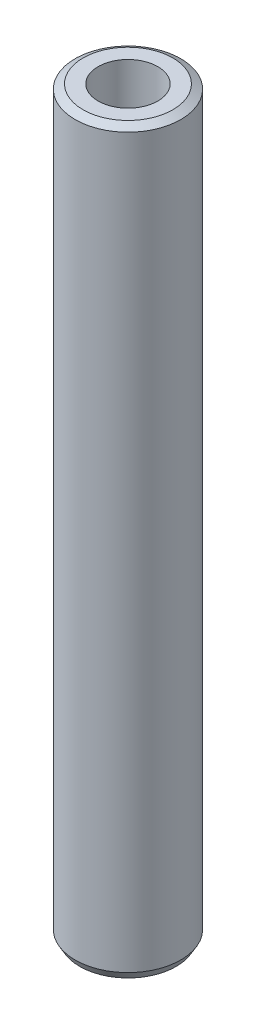
from build123d import *
from OCP.BRepFilletAPI import BRepFilletAPI_MakeChamfer

# Parameters (mm, degrees)
SKETCH1_R           = 37.5
BOSS_EXTRUDE1_DEPTH = 525.698947027
SKETCH2_R           = 21.197430428
CUT_EXTRUDE1_DEPTH  = 529.367185681
CHAMFER1_SIZE       = 3.242616752
CHAMFER1_SIZE2      = 5.616376964


with BuildPart() as part:
    # Sketch1 → Boss-Extrude1 (new body)
    with BuildSketch(Plane(origin=(0, 0, 0), x_dir=(1, 0, 0), z_dir=(0, 1, 0))):
        Circle(SKETCH1_R)
    extrude(amount=BOSS_EXTRUDE1_DEPTH)

    # Sketch2 → Cut-Extrude1 (cut, through all)
    with BuildSketch(Plane(origin=(0, 0, 0), x_dir=(1, 0, 0), z_dir=(0, 1, 0))):
        Circle(SKETCH2_R)
    extrude(amount=CUT_EXTRUDE1_DEPTH, mode=Mode.SUBTRACT)

    # Chamfer1: one chamfer whose edges measure the first distance from different faces: ONE call of the kernel's chamfer builder (chamfer() names one face for all edges)
    chamfer1_edges_1 = [part.edges().sort_by_distance(p)[0] for p in [
        (-37.5, 525.698947027, 0),
    ]]
    chamfer1_side_1 = [part.faces().sort_by_distance(p)[0] for p in [
        (-37.5, 262.849473513, 0),
    ]]
    chamfer1_edges_2 = [part.edges().sort_by_distance(p)[0] for p in [
        (-37.5, 0, 0),
    ]]
    chamfer1_side_2 = [part.faces().sort_by_distance(p)[0] for p in [
        (-36.439339828, 0, 0),
    ]]
    chamfer1 = BRepFilletAPI_MakeChamfer(part.part.solid().wrapped)
    for e in chamfer1_edges_1:
        chamfer1.Add(CHAMFER1_SIZE, CHAMFER1_SIZE2, e.wrapped, chamfer1_side_1[0].wrapped)  # the first distance lies on this face
    for e in chamfer1_edges_2:
        chamfer1.Add(CHAMFER1_SIZE, CHAMFER1_SIZE2, e.wrapped, chamfer1_side_2[0].wrapped)  # the first distance lies on this face
    add(Compound.cast(chamfer1.Shape()), mode=Mode.REPLACE)


solid = part.part
